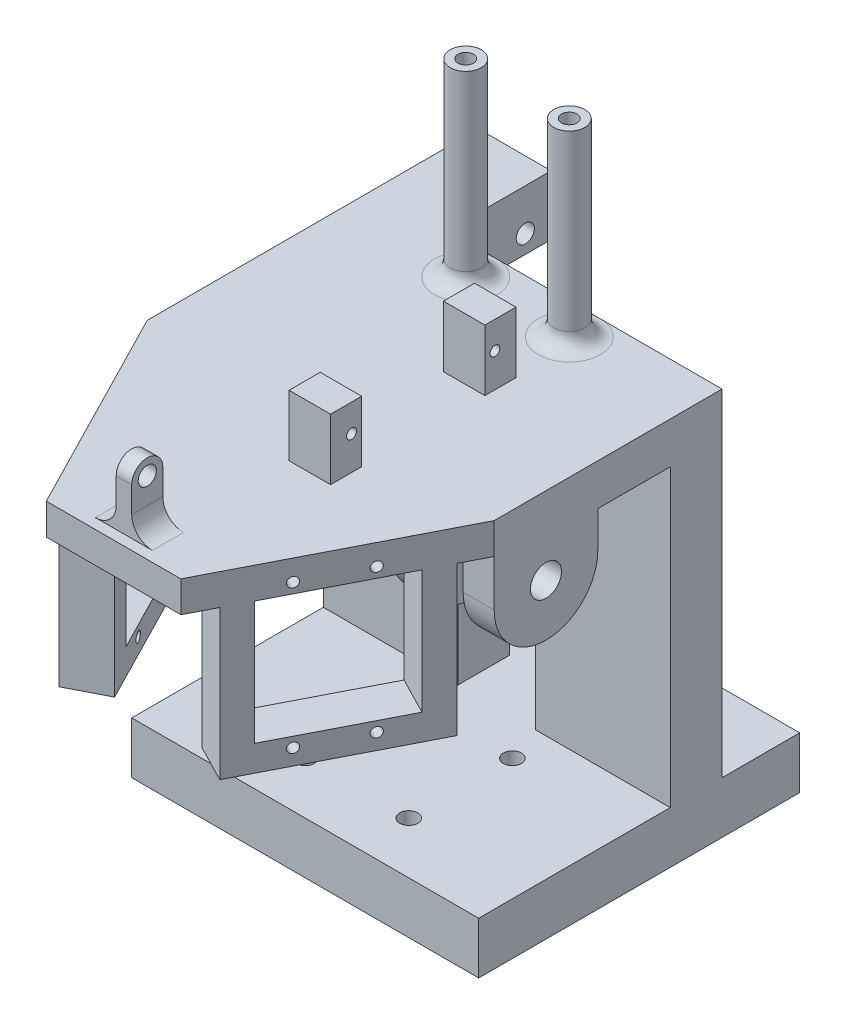
from build123d import *

# Parameters (mm, degrees)
SKETCH_1_W             = 67
SKETCH_1_H             = 62
EXTRUDE_1_DEPTH        = 10
SKETCH_3_W             = 14
SKETCH_3_H             = 20
EXTRUDE_2_DEPTH        = 12.5
SKETCH_4_W             = 10
SKETCH_4_H             = 65
EXTRUDE_3_DEPTH        = 67
SKETCH_5_W             = 67
SKETCH_5_H             = 44
EXTRUDE_4_DEPTH        = 8
EXTRUDE_5_DEPTH        = 20
CUT_EXTRUDE_START      = -6
CUT_EXTRUDE_1_DEPTH    = 8
EXTRUDE_6_DEPTH        = 6
SKETCH_9_R             = 3
CUT_EXTRUDE_2_DEPTH    = 23
SKETCH_10_W            = 24
SKETCH_10_H            = 23.8
EXTRUDE_7_DEPTH        = 8
SKETCH_12_W            = 14
SKETCH_12_H            = 20
EXTRUDE_8_DEPTH        = 11.5
SKETCH_13_R            = 0.95
CUT_EXTRUDE_4_DEPTH    = 8
SKETCH_14_W            = 8
SKETCH_14_H            = 6
EXTRUDE_9_DEPTH        = 11.8
SKETCH_15_R            = 0.95
CUT_EXTRUDE_5_DEPTH    = 11.8
SKETCH_16_W            = 3
SKETCH_16_H            = 6
EXTRUDE_10_DEPTH       = 12
FILLET_1_RADIUS        = 3
FILLET_1_LENGTH        = 3
SKETCH_17_R            = 1.75
CUT_EXTRUDE_6_DEPTH    = 7
SKETCH_18_R            = 3
EXTRUDE_11_DEPTH       = 36.5
FILLET_2_R             = 3
FILLET_2_OF_MIRROR_1_R = 3
SKETCH_20_R            = 1.75
CUT_EXTRUDE_7_DEPTH    = 35
SKETCH_21_W            = 15
SKETCH_21_H            = 55
CUT_EXTRUDE_8_DEPTH    = 35
SKETCH_24_R            = 1.75
CUT_EXTRUDE_11_DEPTH   = 18
SKETCH_25_R            = 1.5
CUT_EXTRUDE_12_DEPTH   = 10
FILLET_3_R             = 4
SKETCH_26_W            = 10.3
SKETCH_26_H            = 3.8
EXTRUDE_12_DEPTH       = 1
SKETCH_27_R            = 1.4
CUT_EXTRUDE_13_DEPTH   = 4


with BuildPart() as part:
    # 草图1 → 凸台-拉伸1 (new body)
    with BuildSketch(Plane(origin=(0, 0, 0), x_dir=(1, 0, 0), z_dir=(0, 1, 0))):
        Rectangle(SKETCH_1_W, SKETCH_1_H)
    extrude(amount=EXTRUDE_1_DEPTH)

    # 草图3 → 凸台-拉伸2 (add)
    with BuildSketch(Plane(origin=(0, 10, 0), x_dir=(1, 0, 0), z_dir=(0, 1, 0))):
        with Locations((-26.5, 26)):
            Rectangle(SKETCH_3_W, SKETCH_3_H)
    extrude(amount=EXTRUDE_2_DEPTH)

    # 草图4 → 凸台-拉伸3 (add)
    with BuildSketch(Plane.ZY.offset(33.5)):
        with Locations((-11, 42.5)):
            Rectangle(SKETCH_4_W, SKETCH_4_H)
    extrude(amount=-EXTRUDE_3_DEPTH)

    # 草图5 → 凸台-拉伸4 (add)
    with BuildSketch(Plane(origin=(0, 75, 0), x_dir=(1, 0, 0), z_dir=(0, 1, 0))):
        with Locations((0, -6)):
            Rectangle(SKETCH_5_W, SKETCH_5_H)
    extrude(amount=-EXTRUDE_4_DEPTH)

    # 草图6 → 凸台-拉伸5 (add)
    with BuildSketch(Plane(origin=(33.5, 0, 0), x_dir=(0, 0, -1), z_dir=(1, 0, 0))):
        with BuildLine():
            Line((-28, 60), (-28, 67))
            Line((-28, 67), (-8, 67))
            Line((-8, 67), (-8, 60))
            ThreePointArc((-8, 60), (-18, 50), (-28, 60))
        make_face()
    extrude_5 = extrude(amount=-EXTRUDE_5_DEPTH)

    # 草图7 → 切除-拉伸1 (cut)
    with BuildSketch(Plane(origin=(33.5, 0, 0), x_dir=(0, 0, -1), z_dir=(1, 0, 0)).offset(CUT_EXTRUDE_START)):
        with BuildLine():
            Line((-28, 60), (-28, 70.000230089))
            Line((-28, 70.000230089), (-8, 70.000230089))
            Line((-8, 70.000230089), (-8, 60))
            ThreePointArc((-8, 60), (-18, 50), (-28, 60))
        make_face()
    cut_extrude_1 = extrude(amount=-CUT_EXTRUDE_1_DEPTH, mode=Mode.SUBTRACT)

    # 草图8 → 凸台-拉伸6 (add)
    with BuildSketch(Plane(origin=(0, 75, 0), x_dir=(1, 0, 0), z_dir=(0, 1, 0))):
        Polygon((0, -68), (13, -68), (33.5, -28), (0, -28), align=None)
    extrude_6 = extrude(amount=-EXTRUDE_6_DEPTH)

    # 草图9 → 切除-拉伸2 (cut)
    with BuildSketch(Plane(origin=(33.5, 0, 0), x_dir=(0, 0, -1), z_dir=(1, 0, 0))):
        with Locations((-18, 60)):
            Circle(SKETCH_9_R)
    cut_extrude_2 = extrude(amount=-CUT_EXTRUDE_2_DEPTH, mode=Mode.SUBTRACT)

    # 草图10 → 凸台-拉伸7 (add)
    with BuildSketch(Plane(origin=(37.896299963, 0, 19.421853731), x_dir=(0.4560907909103985, 0, -0.8899332505568759), z_dir=(0.8899332505568758, 0, 0.45609079091039845))):
        Polygon((-44, 75), (-15, 75), (-15, 40.2), (-43, 40.2), (-49, 40.2), (-49, 75), align=None)
        with Locations((-32, 57.1)):
            Rectangle(SKETCH_10_W, SKETCH_10_H, mode=Mode.SUBTRACT)
    extrude_7 = extrude(amount=-EXTRUDE_7_DEPTH)

    # 草图12 → 凸台-拉伸8 (add)
    with BuildSketch(Plane(origin=(0, 75, 0), x_dir=(1, 0, 0), z_dir=(0, 1, 0))):
        with Locations((-26.5, 26)):
            Rectangle(SKETCH_12_W, SKETCH_12_H)
    extrude(amount=-EXTRUDE_8_DEPTH)

    # 草图13 → 切除-拉伸4 (cut)
    with BuildSketch(Plane(origin=(30.776833958, 0, 15.773127404), x_dir=(-0.4560907909103988, 0, 0.8899332505568758), z_dir=(-0.8899332505568757, 0, -0.4560907909103987))):
        with Locations((38.5, 70.95)):
            Circle(SKETCH_13_R)
        with Locations((26.5, 70.95)):
            Circle(SKETCH_13_R)
        with Locations((26.5, 43.25)):
            Circle(SKETCH_13_R)
        with Locations((38.5, 43.25)):
            Circle(SKETCH_13_R)
    cut_extrude_4 = extrude(amount=-CUT_EXTRUDE_4_DEPTH, mode=Mode.SUBTRACT)

    # 草图14 → 凸台-拉伸9 (add)
    with BuildSketch(Plane(origin=(0, 75, 0), x_dir=(1, 0, 0), z_dir=(0, 1, 0))):
        with Locations((7.7, -5)):
            Rectangle(SKETCH_14_W, SKETCH_14_H)
        with Locations((7.7, -34.8)):
            Rectangle(SKETCH_14_W, SKETCH_14_H)
    extrude(amount=EXTRUDE_9_DEPTH)

    # 草图15 → 切除-拉伸5 (cut)
    with BuildSketch(Plane.ZY.offset(-3.7)):
        with Locations((33.75, 81.5)):
            Circle(SKETCH_15_R)
        with Locations((6.05, 81.5)):
            Circle(SKETCH_15_R)
    extrude(amount=-CUT_EXTRUDE_5_DEPTH, mode=Mode.SUBTRACT)

    # 草图16 → 凸台-拉伸10 (add)
    with BuildSketch(Plane(origin=(0, 75, 0), x_dir=(1, 0, 0), z_dir=(0, 1, 0))):
        with Locations((0, -63)):
            Rectangle(SKETCH_16_W, SKETCH_16_H)
    extrude(amount=EXTRUDE_10_DEPTH)

    # 圆角1: full round fillet: the end face becomes a half cylinder, R = half its width
    fillet_1_face = Plane((0, 87, 63), x_dir=(1, 0, 0), z_dir=(0, 1, 0))  # on the end face: x along it, z out of the body
    fillet_1_slab = fillet_1_face.offset(-FILLET_1_RADIUS / 2) * Box(FILLET_1_LENGTH, 2 * FILLET_1_RADIUS, FILLET_1_RADIUS, mode=Mode.PRIVATE)  # the body's end, R deep
    fillet_1_round = Plane((0, 84, 63), x_dir=(0, 1, 0), z_dir=(1, 0, 0)) * Cylinder(FILLET_1_RADIUS, FILLET_1_LENGTH, mode=Mode.PRIVATE)  # its axis R under the face
    add(fillet_1_slab - fillet_1_round, mode=Mode.SUBTRACT)

    # 草图17 → 切除-拉伸6 (cut)
    with BuildSketch(Plane.ZY.offset(1.5)):
        with Locations((63, 84)):
            Circle(SKETCH_17_R)
    extrude(amount=-CUT_EXTRUDE_6_DEPTH, mode=Mode.SUBTRACT)

    # 草图18 → 凸台-拉伸11 (add)
    with BuildSketch(Plane(origin=(0, 75, 0), x_dir=(1, 0, 0), z_dir=(0, 1, 0))):
        with Locations(Location((10, 10, 0), (0, 0, 270))):
            Circle(SKETCH_18_R)
    extrude_11 = extrude(amount=EXTRUDE_11_DEPTH)

    # 圆角2
    fillet_2_edges = [part.edges().sort_by_distance(p)[0] for p in [
        (10, 75, -13),
    ]]
    fillet(fillet_2_edges, radius=FILLET_2_R - 0.0001)  # a hair under: the kernel refuses the full size

    # 镜向1: 凸台-拉伸5, 切除-拉伸1, 凸台-拉伸6, 切除-拉伸2, 凸台-拉伸7, 切除-拉伸4, 凸台-拉伸11 across plane
    add(extrude_5.mirror(Plane(origin=(0, 0, 0), x_dir=(0, 0, 1), z_dir=(1, 0, 0))))
    add(cut_extrude_1.mirror(Plane(origin=(0, 0, 0), x_dir=(0, 0, 1), z_dir=(1, 0, 0))), mode=Mode.SUBTRACT)
    add(extrude_6.mirror(Plane(origin=(0, 0, 0), x_dir=(0, 0, 1), z_dir=(1, 0, 0))))
    add(cut_extrude_2.mirror(Plane(origin=(0, 0, 0), x_dir=(0, 0, 1), z_dir=(1, 0, 0))), mode=Mode.SUBTRACT)
    add(extrude_7.mirror(Plane(origin=(0, 0, 0), x_dir=(0, 0, 1), z_dir=(1, 0, 0))))
    add(cut_extrude_4.mirror(Plane(origin=(0, 0, 0), x_dir=(0, 0, 1), z_dir=(1, 0, 0))), mode=Mode.SUBTRACT)
    add(extrude_11.mirror(Plane(origin=(0, 0, 0), x_dir=(0, 0, 1), z_dir=(1, 0, 0))))

    # 圆角2 of 镜向1
    fillet_2_of_mirror_1_edges = [part.edges().sort_by_distance(p)[0] for p in [
        (-10, 75, -13),
    ]]
    fillet(fillet_2_of_mirror_1_edges, radius=FILLET_2_OF_MIRROR_1_R - 0.0001)  # a hair under: the kernel refuses the full size

    # 草图20 → 切除-拉伸7 (cut)
    with BuildSketch(Plane.ZY.offset(33.5)):
        with Locations((-31, 67)):
            Circle(SKETCH_20_R)
        with Locations((-21, 67)):
            Circle(SKETCH_20_R)
        with Locations((-31, 19)):
            Circle(SKETCH_20_R)
        with Locations((-21, 19)):
            Circle(SKETCH_20_R)
    extrude(amount=-CUT_EXTRUDE_7_DEPTH, mode=Mode.SUBTRACT)

    # 草图21 → 切除-拉伸8 (cut)
    with BuildSketch(Plane(origin=(0, 0, -16), x_dir=(-1, 0, 0), z_dir=(0, 0, -1))):
        with Locations((0, 37.5)):
            Rectangle(SKETCH_21_W, SKETCH_21_H)
    extrude(amount=-CUT_EXTRUDE_8_DEPTH, mode=Mode.SUBTRACT)

    # 草图24 → 切除-拉伸11 (cut)
    with BuildSketch(Plane(origin=(0, 10, 0), x_dir=(1, 0, 0), z_dir=(0, 1, 0))):
        with Locations(Location((-10, -21, 0), (0, 0, 270))):
            Circle(SKETCH_24_R)
        with Locations(Location((10, -21, 0), (0, 0, 270))):
            Circle(SKETCH_24_R)
        with Locations(Location((-10, -1, 0), (0, 0, 270))):
            Circle(SKETCH_24_R)
        with Locations(Location((10, -1, 0), (0, 0, 270))):
            Circle(SKETCH_24_R)
    extrude(amount=-CUT_EXTRUDE_11_DEPTH, mode=Mode.SUBTRACT)

    # 草图25 → 切除-拉伸12 (cut)
    with BuildSketch(Plane(origin=(0, 111.5, 0), x_dir=(1, 0, 0), z_dir=(0, 1, 0))):
        with Locations(Location((10, 10, 0), (0, 0, 270))):
            Circle(SKETCH_25_R)
        with Locations(Location((-10, 10, 0), (0, 0, 270))):
            Circle(SKETCH_25_R)
    extrude(amount=-CUT_EXTRUDE_12_DEPTH, mode=Mode.SUBTRACT)

    # 圆角3
    fillet_3_edges = [part.edges().sort_by_distance(p)[0] for p in [
        (-1.5, 75, 63),
        (1.5, 75, 63),
    ]]
    fillet(fillet_3_edges, radius=FILLET_3_R)

    # 草图26 → 凸台-拉伸12 (add)
    with BuildSketch(Plane.XZ.offset(-69)):
        with Locations((0.05, 61.98)):
            Rectangle(SKETCH_26_W, SKETCH_26_H)
    extrude(amount=EXTRUDE_12_DEPTH)

    # 草图27 → 切除-拉伸13 (cut)
    with BuildSketch(Plane.XZ.offset(-68)):
        with Locations(Location((0.05, 62, 0), (0, 0, 270))):
            Circle(SKETCH_27_R)
    extrude(amount=-CUT_EXTRUDE_13_DEPTH, mode=Mode.SUBTRACT)


solid = part.part
